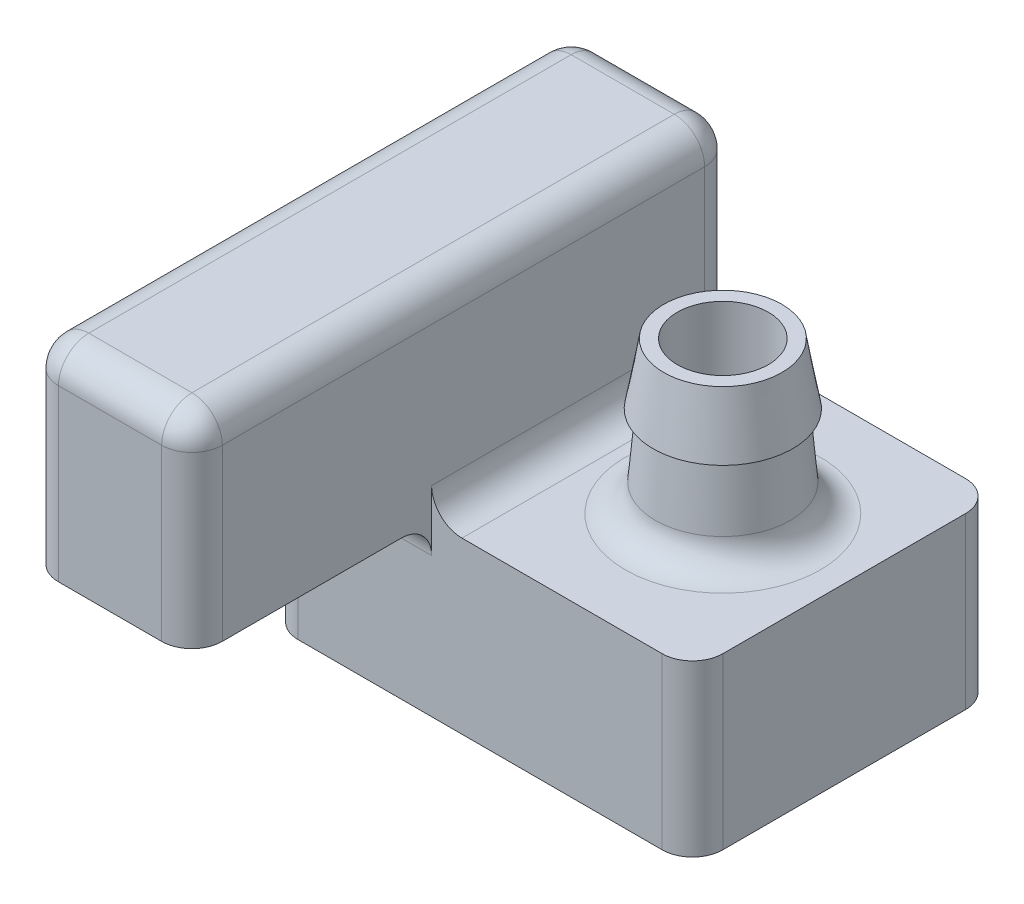
from build123d import *

# Parameters (mm, degrees)
SKETCH1_W               = 7
SKETCH1_H               = 5
SKETCH1_W_2             = 5.8
SKETCH1_H_2             = 3.8
BOSS_EXTRUDE1_DEPTH     = 2.8
SKETCH3_W               = 2.7
SKETCH3_H               = 8.95
SKETCH3_W_2             = 1.5
SKETCH3_H_2             = 7.75
BOSS_EXTRUDE2_DEPTH     = 2.7
SKETCH4_W               = 2.7
SKETCH4_H               = 4.55
BOSS_EXTRUDE3_DEPTH     = 0.6
SKETCH5_W               = 2.7
SKETCH5_H               = 8.95
BOSS_EXTRUDE4_DEPTH     = 0.6
SKETCH6_W               = 4.9
SKETCH6_H               = 5
BOSS_EXTRUDE5_DEPTH     = 0.6
FILLET2_R               = 0.7
SKETCH7_R               = 1
CUT_EXTRUDE1_DEPTH      = 1.7
SKETCH8_R               = 1.15
BOSS_EXTRUDE6_DEPTH     = 1.5
BOSS_EXTRUDE6_DRAFT     = -5
FILLET1_R               = 0.5
BOSS_EXTRUDE7_START     = -1.5
SKETCH8_2_R             = 1.15
BOSS_EXTRUDE7_DEPTH     = 1
BOSS_EXTRUDE7_DRAFT     = -10
CUT_EXTRUDE2_DEPTH      = 10.052209675
CUT_EXTRUDE2_DEPTH_BACK = 10.052209675
SKETCH9_R               = 0.75
FILLET3_R               = 0.5
FILLET5_R               = 0.5
FILLET6_R               = 0.5
FILLET7_R               = 0.5
CHAMFER1_SIZE           = 0.5


with BuildPart() as part:
    # Sketch1 → Boss-Extrude1 (new body)
    with BuildSketch(Plane(origin=(0, 0, 0), x_dir=(1, 0, 0), z_dir=(0, 1, 0))):
        Rectangle(SKETCH1_W, SKETCH1_H)
        Rectangle(SKETCH1_W_2, SKETCH1_H_2, mode=Mode.SUBTRACT)
    extrude(amount=BOSS_EXTRUDE1_DEPTH)

    # Sketch3 → Boss-Extrude2 (add)
    with BuildSketch(Plane(origin=(0, 2.8, 0), x_dir=(1, 0, 0), z_dir=(0, 1, 0))):
        with Locations((-2.15, -1.975)):
            Rectangle(SKETCH3_W, SKETCH3_H)
        with Locations((-2.15, -1.975)):
            Rectangle(SKETCH3_W_2, SKETCH3_H_2, mode=Mode.SUBTRACT)
    extrude(amount=BOSS_EXTRUDE2_DEPTH)

    # Sketch4 → Boss-Extrude3 (add)
    with BuildSketch(Plane.XZ.offset(-2.8)):
        with Locations((-2.15, 4.175)):
            Rectangle(SKETCH4_W, SKETCH4_H)
    extrude(amount=-BOSS_EXTRUDE3_DEPTH)

    # Sketch5 → Boss-Extrude4 (add)
    with BuildSketch(Plane(origin=(0, 5.5, 0), x_dir=(1, 0, 0), z_dir=(0, 1, 0))):
        with Locations((-2.15, -1.975)):
            Rectangle(SKETCH5_W, SKETCH5_H)
    extrude(amount=BOSS_EXTRUDE4_DEPTH)

    # Sketch6 → Boss-Extrude5 (add)
    with BuildSketch(Plane(origin=(0, 2.8, 0), x_dir=(1, 0, 0), z_dir=(0, 1, 0))):
        with Locations((1.05, 0)):
            Rectangle(SKETCH6_W, SKETCH6_H)
    extrude(amount=-BOSS_EXTRUDE5_DEPTH)

    # Fillet2
    fillet2_edges = [part.edges().sort_by_distance(p)[0] for p in [
        (-2.15, 5.5, -1.9),
        (-1.4, 5.5, 1.975),
        (-2.15, 5.5, 5.85),
        (-2.9, 5.5, 1.975),
    ]]
    fillet(fillet2_edges, radius=FILLET2_R)

    # Sketch7 → Cut-Extrude1 (cut)
    with BuildSketch(Plane.XZ.offset(-2.8)):
        with Locations(Location((-2.15, 4.85, 0), (0, 0, 270))):
            Circle(SKETCH7_R)
    extrude(amount=-CUT_EXTRUDE1_DEPTH, mode=Mode.SUBTRACT)


with BuildPart() as boss_extrude6_tool:
    # Sketch8 → Boss-Extrude6 (with draft: the straight prism first)
    with BuildSketch(Plane(origin=(0, 2.8, 0), x_dir=(-1, 0, 0), z_dir=(0, -1, 0))):
        with Locations((-1.5, 0)):
            Circle(SKETCH8_R)
    extrude(amount=-BOSS_EXTRUDE6_DEPTH)
    # Boss-Extrude6: the draft: its side faces are tilted about the plane it starts from
    boss_extrude6_sides = [boss_extrude6_tool.faces().sort_by_distance(p)[0] for p in [
        (2.65, 3.55, 0),
    ]]
    draft(boss_extrude6_sides, Plane(origin=(0, 2.8, 0), x_dir=(-1, 0, 0), z_dir=(0, -1, 0)), BOSS_EXTRUDE6_DRAFT)


with BuildPart() as part_1:
    add(part.part)

    # Boss-Extrude6: add boss_extrude6_tool
    add(boss_extrude6_tool.part)

    # Fillet1
    fillet1_edges = [part_1.edges().sort_by_distance(p)[0] for p in [
        (2.65, 2.8, 0),
    ]]
    fillet(fillet1_edges, radius=FILLET1_R)


with BuildPart() as boss_extrude7_tool:
    # Sketch8<2> → Boss-Extrude7 (with draft: the straight prism first)
    with BuildSketch(Plane(origin=(0, 2.8, 0), x_dir=(-1, 0, 0), z_dir=(0, -1, 0)).offset(BOSS_EXTRUDE7_START)):
        with Locations((-1.5, 0)):
            Circle(SKETCH8_2_R)
    extrude(amount=-BOSS_EXTRUDE7_DEPTH)
    # Boss-Extrude7: the draft: its side faces are tilted about the plane it starts from
    boss_extrude7_sides = [boss_extrude7_tool.faces().sort_by_distance(p)[0] for p in [
        (2.65, 4.8, 0),
    ]]
    draft(boss_extrude7_sides, Plane(origin=(0, 2.8, 0), x_dir=(-1, 0, 0), z_dir=(0, -1, 0)).offset(BOSS_EXTRUDE7_START), BOSS_EXTRUDE7_DRAFT)


with BuildPart() as part_2:
    add(part_1.part)

    # Boss-Extrude7: add boss_extrude7_tool
    add(boss_extrude7_tool.part)

    # Sketch9 → Cut-Extrude2 (cut, two sides: drawn at the far end of the back side and taken through both)
    with BuildSketch(Plane(origin=(0, 5.3, 0), x_dir=(1, 0, 0), z_dir=(0, 1, 0)).offset(-CUT_EXTRUDE2_DEPTH_BACK)):
        with Locations(Location((1.5, 0, 0), (0, 0, 90))):
            Circle(SKETCH9_R)
    extrude(amount=CUT_EXTRUDE2_DEPTH + CUT_EXTRUDE2_DEPTH_BACK, mode=Mode.SUBTRACT)

    # Fillet3
    fillet3_edges = [part_2.edges().sort_by_distance(p)[0] for p in [
        (-3.5, 6.1, 1.975),
        (-2.15, 6.1, 6.45),
        (-0.8, 6.1, 1.975),
        (-2.15, 6.1, -2.5),
    ]]
    fillet(fillet3_edges, radius=FILLET3_R)

    # Fillet5
    # the kernel refuses this fillet: 0.5 mm, written as the material it takes off along each edge
    with BuildSketch(Plane(origin=(-1.3, 5.6, -2), x_dir=(1, 0, 0), z_dir=(0, 0, -1))) as fillet5_piece_1_section:
        Polygon((0, 0), (FILLET5_R, 0), (FILLET5_R, -FILLET5_R), (0, -FILLET5_R), align=None)
    fillet5_piece_1 = extrude(amount=FILLET5_R, mode=Mode.PRIVATE)
    fillet5_piece_1 = fillet5_piece_1 - Plane(origin=(-1.3, 5.6, -2), x_dir=(-0.7071067811865475, -0.7071067811865475, 0), z_dir=(0, 0, -1)) * Sphere(FILLET5_R, mode=Mode.PRIVATE)
    add(fillet5_piece_1, mode=Mode.SUBTRACT)
    with BuildSketch(Plane(origin=(-1.3, 5.6, 5.95), x_dir=(0, 0, 1), z_dir=(1, 0, 0))) as fillet5_piece_2_section:
        Polygon((0, 0), (FILLET5_R, 0), (FILLET5_R, -FILLET5_R), (0, -FILLET5_R), align=None)
    fillet5_piece_2 = extrude(amount=FILLET5_R, mode=Mode.PRIVATE)
    fillet5_piece_2 = fillet5_piece_2 - Plane(origin=(-1.3, 5.6, 5.95), x_dir=(0, -0.7071067811865475, -0.7071067811865475), z_dir=(1, 0, 0)) * Sphere(FILLET5_R, mode=Mode.PRIVATE)
    add(fillet5_piece_2, mode=Mode.SUBTRACT)
    with BuildSketch(Plane(origin=(-3, 5.6, -2), x_dir=(-1, 0, 0), z_dir=(0, 0, -1))) as fillet5_piece_3_section:
        Polygon((0, 0), (FILLET5_R, 0), (FILLET5_R, FILLET5_R), (0, FILLET5_R), align=None)
    fillet5_piece_3 = extrude(amount=FILLET5_R, mode=Mode.PRIVATE)
    fillet5_piece_3 = fillet5_piece_3 - Plane(origin=(-3, 5.6, -2), x_dir=(0.7071067811865475, -0.7071067811865475, 0), z_dir=(0, 0, -1)) * Sphere(FILLET5_R, mode=Mode.PRIVATE)
    add(fillet5_piece_3, mode=Mode.SUBTRACT)
    with BuildSketch(Plane(origin=(-3, 5.6, 5.95), x_dir=(0, 0, 1), z_dir=(-1, 0, 0))) as fillet5_piece_4_section:
        Polygon((0, 0), (FILLET5_R, 0), (FILLET5_R, FILLET5_R), (0, FILLET5_R), align=None)
    fillet5_piece_4 = extrude(amount=FILLET5_R, mode=Mode.PRIVATE)
    fillet5_piece_4 = fillet5_piece_4 - Plane(origin=(-3, 5.6, 5.95), x_dir=(0, -0.7071067811865475, -0.7071067811865475), z_dir=(-1, 0, 0)) * Sphere(FILLET5_R, mode=Mode.PRIVATE)
    add(fillet5_piece_4, mode=Mode.SUBTRACT)
    with BuildSketch(Plane(origin=(-3.5, 1.55, 6.45), x_dir=(0, 0, -1), z_dir=(0, 1, 0)), Plane(origin=(-0.8, 5.6, 6.45), x_dir=(0, 0, -1), z_dir=(0, -1, 0)), Plane(origin=(-3.5, -1.25, 2.5), x_dir=(0, 0, -1), z_dir=(0, 1, 0))) as fillet5_piece_5:
        with BuildLine():
            CenterArc((FILLET5_R, -FILLET5_R), FILLET5_R, 90, 90)
            Line((0, -FILLET5_R), (0, 0))
            Line((0, 0), (FILLET5_R, 0))
        make_face()
    extrude(amount=4.05, mode=Mode.SUBTRACT)
    with BuildSketch(Plane(origin=(-3.5, -1.25, -2.5), x_dir=(1, 0, 0), z_dir=(0, 1, 0))) as fillet5_piece_6:
        with BuildLine():
            CenterArc((FILLET5_R, -FILLET5_R), FILLET5_R, 90, 90)
            Line((0, -FILLET5_R), (0, 0))
            Line((0, 0), (FILLET5_R, 0))
        make_face()
    extrude(amount=6.85, mode=Mode.SUBTRACT)
    with BuildSketch(Plane(origin=(-0.8, 5.6, -2.5), x_dir=(-1, 0, 0), z_dir=(0, -1, 0))) as fillet5_piece_7:
        with BuildLine():
            CenterArc((FILLET5_R, -FILLET5_R), FILLET5_R, 90, 90)
            Line((0, -FILLET5_R), (0, 0))
            Line((0, 0), (FILLET5_R, 0))
        make_face()
    extrude(amount=2.8, mode=Mode.SUBTRACT)
    with BuildSketch(Plane(origin=(3.5, 4.05, -2.5), x_dir=(-1, 0, 0), z_dir=(0, -1, 0)), Plane(origin=(3.5, 4.05, 2.5), x_dir=(0, 0, -1), z_dir=(0, -1, 0))) as fillet5_piece_8:
        with BuildLine():
            CenterArc((FILLET5_R, -FILLET5_R), FILLET5_R, 90, 90)
            Line((0, -FILLET5_R), (0, 0))
            Line((0, 0), (FILLET5_R, 0))
        make_face()
    extrude(amount=5.3, mode=Mode.SUBTRACT)

    # Fillet6
    # the kernel refuses this fillet: 0.5 mm, written as the material it adds along each edge
    with BuildSketch(Plane(origin=(-1.3, 2.8, -2), x_dir=(-0.5976672776328278, 0, 0.8017442392976482), z_dir=(0.8017442392976482, 0, 0.5976672776328278))) as fillet6_piece_1_section:
        with BuildLine():
            CenterArc((0.5 + FILLET6_R, -FILLET6_R), FILLET6_R, 90, 90)
            Line((0.5, -FILLET6_R), (0.5, 0))
            Line((0.5, 0), (0.5 + FILLET6_R, 0))
        make_face()
    fillet6_piece_1 = revolve(axis=Axis((-1.3, 2.8, -2), (0, -1, 0)), revolution_arc=233.296989237, mode=Mode.PRIVATE)
    fillet6_piece_1 = split(fillet6_piece_1, bisect_by=Plane(origin=(-0.925030534, 2.955814156, -2.5), z_dir=(0, 0, 1)), keep=Keep.TOP, mode=Mode.PRIVATE)
    fillet6_piece_1 = split(fillet6_piece_1, bisect_by=Plane(origin=(-0.925030534, 2.955814156, -1.9), z_dir=(0, 0, -1)), keep=Keep.TOP, mode=Mode.PRIVATE)
    add(fillet6_piece_1)
    with BuildSketch(Plane(origin=(-0.8, 2.8, 2.5), x_dir=(1, 0, 0), z_dir=(0, 0, -1))) as fillet6_piece_2:
        with BuildLine():
            CenterArc((FILLET6_R, -FILLET6_R), FILLET6_R, 90, 90)
            Line((0, -FILLET6_R), (0, 0))
            Line((0, 0), (FILLET6_R, 0))
        make_face()
    extrude(amount=4.5)

    # Fillet7
    # the kernel refuses this fillet: 0.5 mm, written as the material it adds along each edge
    with BuildSketch(Plane(origin=(-0.8, 2.8, 2.5), x_dir=(0, -1, 0), z_dir=(-1, 0, 0))) as fillet7_piece_1:
        with BuildLine():
            CenterArc((FILLET7_R, FILLET7_R), FILLET7_R, 180, 90)
            Line((0, FILLET7_R), (0, 0))
            Line((0, 0), (FILLET7_R, 0))
        make_face()
    extrude(amount=2.2)
    with BuildSketch(Plane(origin=(-3, 2.8, 2), x_dir=(0.8017442392976479, 0, -0.597667277632828), z_dir=(0.597667277632828, 0, 0.8017442392976479))) as fillet7_piece_2_section:
        with BuildLine():
            CenterArc((0.5 + FILLET7_R, -FILLET7_R), FILLET7_R, 90, 90)
            Line((0.5, -FILLET7_R), (0.5, 0))
            Line((0.5, 0), (0.5 + FILLET7_R, 0))
        make_face()
    fillet7_piece_2 = revolve(axis=Axis((-3, 2.8, 2), (0, 1, 0)), revolution_arc=233.296989237, mode=Mode.PRIVATE)
    fillet7_piece_2 = split(fillet7_piece_2, bisect_by=Plane(origin=(-3.5, 2.644185551, 2.37496936), z_dir=(1, 0, 0)), keep=Keep.TOP, mode=Mode.PRIVATE)
    fillet7_piece_2 = split(fillet7_piece_2, bisect_by=Plane(origin=(-2.9, 2.644185551, 2.37496936), z_dir=(-1, 0, 0)), keep=Keep.TOP, mode=Mode.PRIVATE)
    add(fillet7_piece_2)

    # Chamfer1
    chamfer1_edges = [part_2.edges().sort_by_distance(p)[0] for p in [
        (-2.15, 3.4, 1.9),
    ]]
    chamfer(chamfer1_edges, length=CHAMFER1_SIZE)


solid = part_2.part
